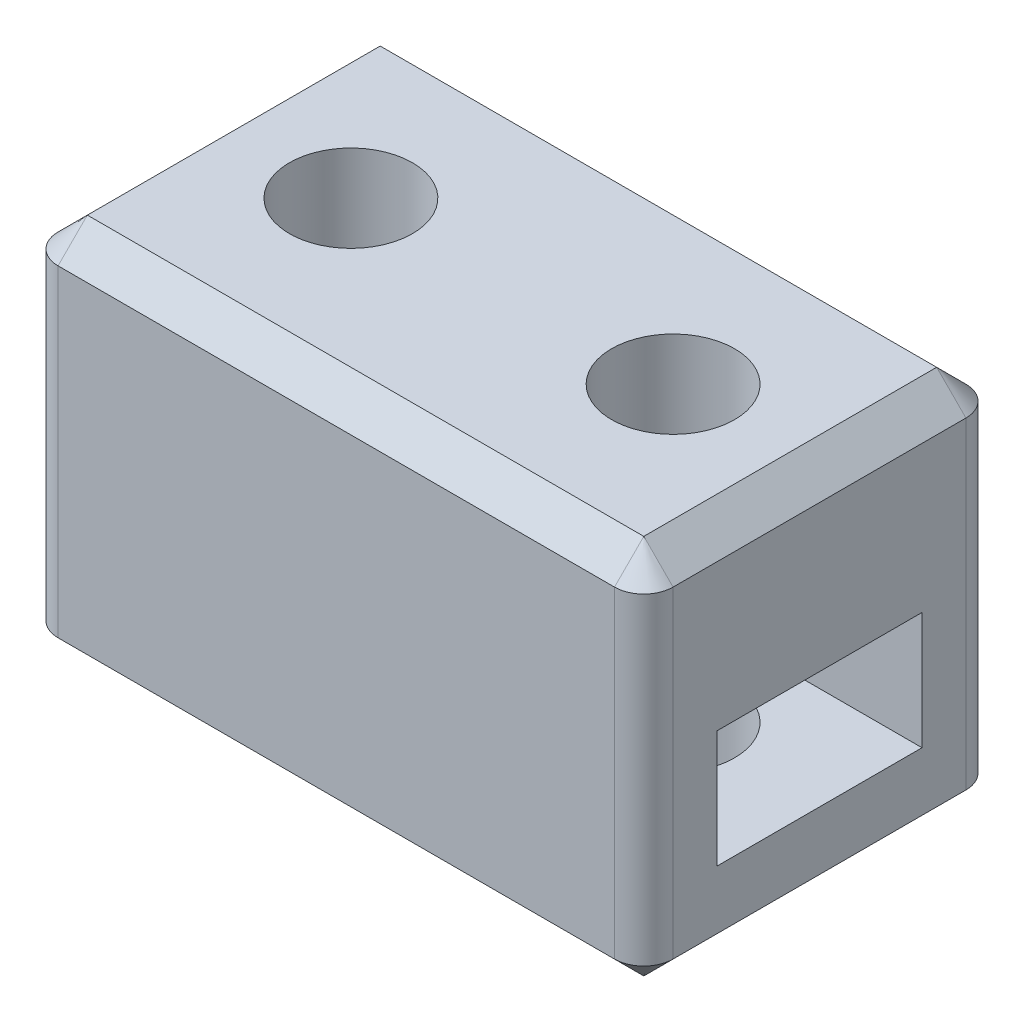
from build123d import *

# Parameters (mm, degrees)
SKETCH2_W           = 21
SKETCH2_H           = 12
SKETCH2_R           = 2.1
BOSS_EXTRUDE1_DEPTH = 13
SKETCH7_W           = 7
SKETCH7_H           = 4
CUT_EXTRUDE3_DEPTH  = 10
FILLET1_R           = 1
CHAMFER1_SIZE       = 1


with BuildPart() as part:
    # Sketch2 → Boss-Extrude1 (new body)
    with BuildSketch(Plane(origin=(0, 0, 0), x_dir=(1, 0, 0), z_dir=(0, 1, 0))):
        Rectangle(SKETCH2_W, SKETCH2_H)
        with Locations((-5.5, 0)):
            Circle(SKETCH2_R, mode=Mode.SUBTRACT)
        with Locations((5.5, 0)):
            Circle(SKETCH2_R, mode=Mode.SUBTRACT)
    extrude(amount=BOSS_EXTRUDE1_DEPTH)

    # Sketch7 → Cut-Extrude3 (cut)
    with BuildSketch(Plane(origin=(10.5, 0, 0), x_dir=(0, 0, -1), z_dir=(1, 0, 0))):
        with Locations((0, 5)):
            Rectangle(SKETCH7_W, SKETCH7_H)
    cut_extrude3 = extrude(amount=-CUT_EXTRUDE3_DEPTH, mode=Mode.SUBTRACT)

    # Mirror1: Cut-Extrude3 across plane
    add(cut_extrude3.mirror(Plane(origin=(0, 0, 0), x_dir=(0, 0, 1), z_dir=(1, 0, 0))), mode=Mode.SUBTRACT)

    # Fillet1
    fillet1_edges = [part.edges().sort_by_distance(p)[0] for p in [
        (-10.5, 6.5, 6),
        (-10.5, 6.5, -6),
        (10.5, 6.5, -6),
        (10.5, 6.5, 6),
    ]]
    fillet(fillet1_edges, radius=FILLET1_R)

    # Chamfer1
    chamfer1_edges = [part.edges().sort_by_distance(p)[0] for p in [
        (0, 0, -6),
        (-10.207106781, 0, -5.707106781),
        (10.207106781, 0, -5.707106781),
        (-10.5, 0, 0),
        (10.5, 0, 0),
        (-10.207106781, 0, 5.707106781),
        (10.207106781, 0, 5.707106781),
        (0, 0, 6),
        (0, 13, -6),
        (-10.207106781, 13, -5.707106781),
        (10.207106781, 13, -5.707106781),
        (-10.5, 13, 0),
        (10.5, 13, 0),
        (-10.207106781, 13, 5.707106781),
        (10.207106781, 13, 5.707106781),
        (0, 13, 6),
    ]]
    chamfer(chamfer1_edges, length=CHAMFER1_SIZE)


solid = part.part
